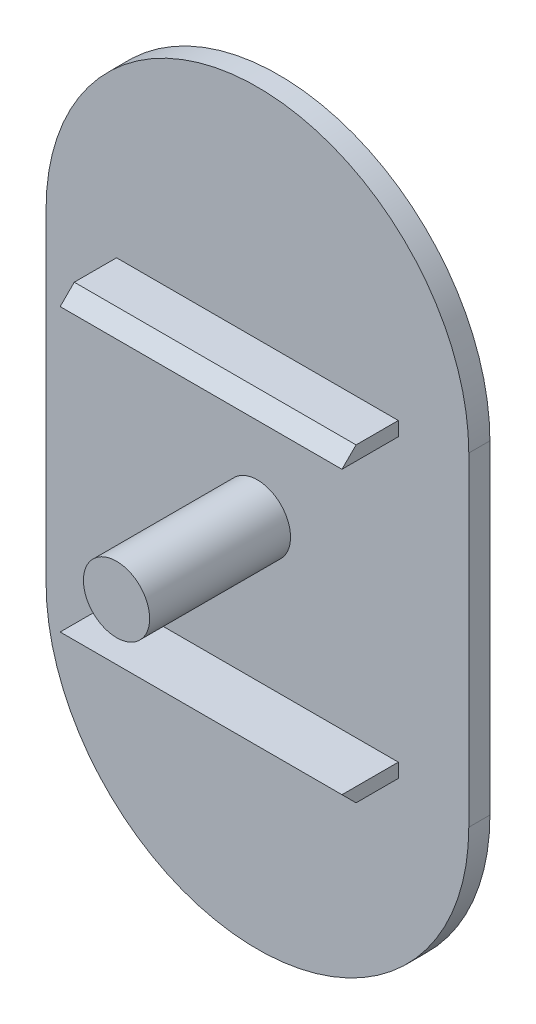
from build123d import *

# Parameters (mm, degrees)
DODANIE_WYCI_GNI_CIE2_DEPTH = 1.5
SZKIC37_R                   = 1.85
DODANIE_WYCI_GNI_CIE3_DEPTH = 1.5
SZKIC38_R                   = 3.85
DODANIE_WYCI_GNI_CIE4_DEPTH = 1.7
ZAOKR_GLENIE1_R             = 2
SZKIC39_R                   = 2.35
DODANIE_WYCI_GNI_CIE5_DEPTH = 10
SZKIC40_W                   = 20
SZKIC40_H                   = 1
DODANIE_WYCI_GNI_CIE6_DEPTH = 4
SFAZOWANIE1_SIZE            = 1


# Some blends are built 0.0001 mm under size
with BuildPart() as part:
    # Szkic35 → Dodanie-wyciągnięcie2 (new body)
    with BuildSketch(Plane.XY):
        with BuildLine():
            Line((-15, -11.5), (-15, 11.5))
            ThreePointArc((-15, 11.5), (0, 26.5), (15, 11.5))
            Line((15, 11.5), (15, -11.5))
            ThreePointArc((15, -11.5), (0, -26.5), (-15, -11.5))
        make_face()
    extrude(amount=DODANIE_WYCI_GNI_CIE2_DEPTH)

    # Szkic37 → Dodanie-wyciągnięcie3 (add)
    with BuildSketch(Plane(origin=(0, 0, 0), x_dir=(-1, 0, 0), z_dir=(0, 0, -1))):
        with Locations((0, 12.5)):
            Circle(SZKIC37_R)
        with Locations((0, -12.5)):
            Circle(SZKIC37_R)
    extrude(amount=DODANIE_WYCI_GNI_CIE3_DEPTH)

    # Szkic38 → Dodanie-wyciągnięcie4 (add)
    with BuildSketch(Plane(origin=(0, 0, -1.5), x_dir=(-1, 0, 0), z_dir=(0, 0, -1))):
        with Locations((0, 12.5)):
            Circle(SZKIC38_R)
        with Locations((0, -12.5)):
            Circle(SZKIC38_R)
    extrude(amount=DODANIE_WYCI_GNI_CIE4_DEPTH)

    # Zaokrąglenie1
    # the kernel refuses this fillet: 2 mm, written as the material it takes off along each edge
    with BuildSketch(Plane(origin=(0, 12.5, -3.2), x_dir=(-1, 0, 0), z_dir=(0, -1, 0))) as zaokr_glenie1_piece_1:
        with BuildLine():
            CenterArc((1.872628007, -2), ZAOKR_GLENIE1_R, 8.626926559, 81.373073441)
            Line((1.872628007, 0), (1.872628007, 0.04))
            Line((1.872628007, 0.04), (3.85, 0.04))
            Line((3.85, 0.04), (3.89, 0))
            ThreePointArc((3.89, 0), (3.89, -0.85), (3.88954744, -1.694))
            Line((3.88954744, -1.694), (3.85, -1.7))
        make_face()
    revolve(axis=Axis((0, 12.5, -3.2), (0, 0, -1)), mode=Mode.SUBTRACT)
    with BuildSketch(Plane(origin=(0, -12.5, -3.2), x_dir=(-1, 0, 0), z_dir=(0, -1, 0))) as zaokr_glenie1_piece_2:
        with BuildLine():
            CenterArc((1.872628007, -2), ZAOKR_GLENIE1_R, 8.626926559, 81.373073441)
            Line((1.872628007, 0), (1.872628007, 0.04))
            Line((1.872628007, 0.04), (3.85, 0.04))
            Line((3.85, 0.04), (3.89, 0))
            ThreePointArc((3.89, 0), (3.89, -0.85), (3.88954744, -1.694))
            Line((3.88954744, -1.694), (3.85, -1.7))
        make_face()
    revolve(axis=Axis((0, -12.5, -3.2), (0, 0, -1)), mode=Mode.SUBTRACT)

    # Szkic39 → Dodanie-wyciągnięcie5 (add)
    with BuildSketch(Plane.XY.offset(1.5)):
        with Locations(Location((0, 0, 0), (0, 0, 180))):
            Circle(SZKIC39_R)
    extrude(amount=DODANIE_WYCI_GNI_CIE5_DEPTH)

    # Szkic40 → Dodanie-wyciągnięcie6 (add)
    with BuildSketch(Plane.XY.offset(1.5)):
        with Locations((0, 10.5)):
            Rectangle(SZKIC40_W, SZKIC40_H)
        with Locations((0, -10.5)):
            Rectangle(SZKIC40_W, SZKIC40_H)
    extrude(amount=DODANIE_WYCI_GNI_CIE6_DEPTH)

    # Sfazowanie1
    sfazowanie1_edges = [part.edges().sort_by_distance(p)[0] for p in [
        (0, 11, 5.5),
        (0, -11, 5.5),
    ]]
    chamfer(sfazowanie1_edges, length=SFAZOWANIE1_SIZE - 0.0001)  # a hair under: the kernel refuses the full size


solid = part.part
